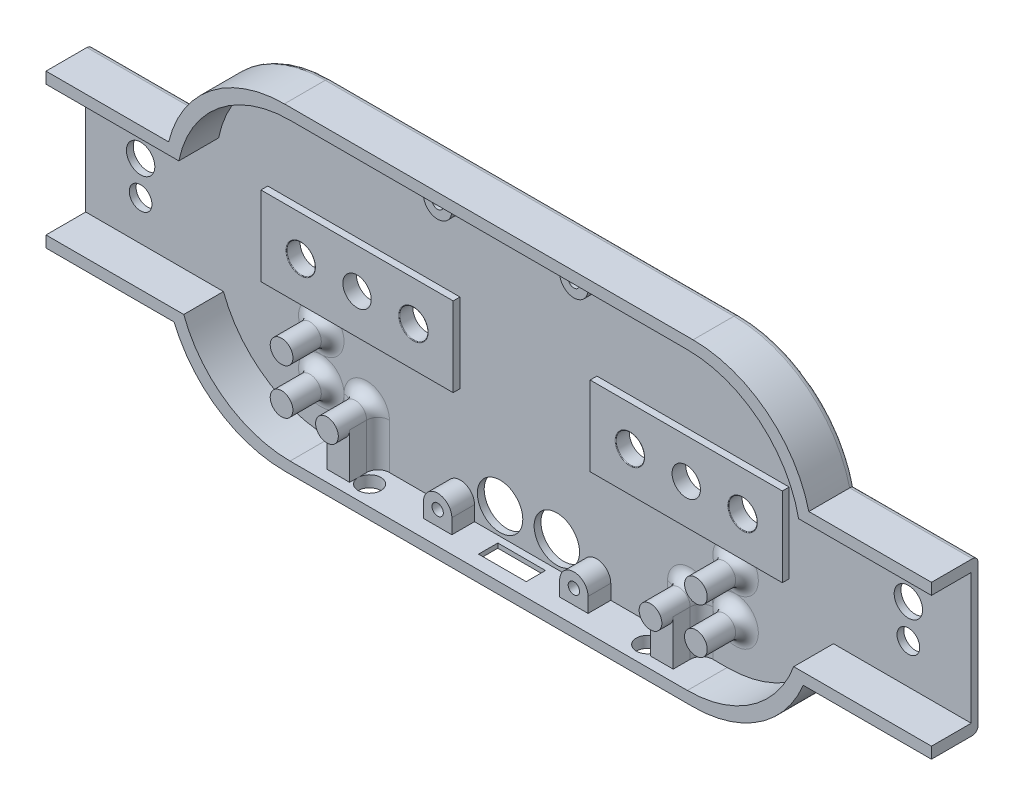
from build123d import *

# Parameters (mm, degrees)
SKETCH_1_W          = 114
SKETCH_1_H          = 56
SKETCH_1_W_2        = 110
SKETCH_1_H_2        = 52
EXTRUDE_1_DEPTH     = 7
SKETCH_3_W          = 114
SKETCH_3_H          = 56
EXTRUDE_2_DEPTH     = 1.2
SKETCH_4_R          = 2.5
CUT_EXTRUDE_1_DEPTH = 1.2
FILLET_2_R          = 20
FILLET_3_R          = 21
SKETCH_5_W          = 33.86
SKETCH_5_H          = 14
EXTRUDE_3_DEPTH     = 1.2
SKETCH_6_R          = 2.5
CUT_EXTRUDE_2_DEPTH = 1.2
FILLET_4_R          = 0.1
SKETCH_7_W          = 23
SKETCH_7_H          = 27
EXTRUDE_4_DEPTH     = 8.2
SKETCH_8_W          = 25
SKETCH_8_H          = 23
CUT_EXTRUDE_3_DEPTH = 7
FILLET_6_R          = 1
SKETCH_9_R          = 2.5
SKETCH_9_R_2        = 2
CUT_EXTRUDE_4_DEPTH = 1.2
SKETCH_10_R         = 2.5
EXTRUDE_5_DEPTH     = 4
SKETCH_11_R         = 1
CUT_EXTRUDE_5_DEPTH = 3
SKETCH_12_W         = 8.4
SKETCH_12_H         = 3.4
CUT_EXTRUDE_6_DEPTH = 3
SKETCH_13_W         = 12.4
SKETCH_13_H         = 6.2
CUT_EXTRUDE_7_DEPTH = 1.2
EXTRUDE_6_DEPTH     = 4
SKETCH_15_R         = 4
CUT_EXTRUDE_8_DEPTH = 4
SKETCH_17_R         = 2
CUT_EXTRUDE_9_DEPTH = 5
SKETCH_18_R         = 2
EXTRUDE_8_DEPTH     = 7
SKETCH_19_W         = 4
SKETCH_19_H         = 8
EXTRUDE_9_DEPTH     = 5
FILLET_10_R         = 2


with BuildPart() as part:
    # Эскиз1 → Вытянуть-Тонкостенный1 (new body)
    with BuildSketch(Plane.XY):
        Rectangle(SKETCH_1_W, SKETCH_1_H)
        Rectangle(SKETCH_1_W_2, SKETCH_1_H_2, mode=Mode.SUBTRACT)
    extrude(amount=EXTRUDE_1_DEPTH)

    # Эскиз3 → Бобышка-Вытянуть2 (add)
    with BuildSketch(Plane(origin=(0, 0, 0), x_dir=(-1, 0, 0), z_dir=(0, 0, -1))):
        Rectangle(SKETCH_3_W, SKETCH_3_H)
    extrude(amount=EXTRUDE_2_DEPTH)

    # Эскиз4 → Вырез-Вытянуть1 (cut)
    with BuildSketch(Plane(origin=(0, 0, -1.2), x_dir=(-1, 0, 0), z_dir=(0, 0, -1))):
        with Locations((29, 0)):
            Circle(SKETCH_4_R)
        with Locations((-29, 0)):
            Circle(SKETCH_4_R)
        with Locations((38.93, 0)):
            Circle(SKETCH_4_R)
        with Locations((19.07, 0)):
            Circle(SKETCH_4_R)
        with Locations((-19.07, 0)):
            Circle(SKETCH_4_R)
        with Locations((-38.93, 0)):
            Circle(SKETCH_4_R)
    extrude(amount=-CUT_EXTRUDE_1_DEPTH, mode=Mode.SUBTRACT)

    # Скругление2
    fillet_2_edges = [part.edges().sort_by_distance(p)[0] for p in [
        (-55, 26, 3.5),
        (-55, -26, 3.5),
        (55, -26, 3.5),
        (55, 26, 3.5),
    ]]
    fillet(fillet_2_edges, radius=FILLET_2_R)

    # Скругление3
    fillet_3_edges = [part.edges().sort_by_distance(p)[0] for p in [
        (-57, 28, 2.9),
        (57, 28, 2.9),
        (57, -28, 2.9),
        (-57, -28, 2.9),
    ]]
    fillet(fillet_3_edges, radius=FILLET_3_R)

    # Эскиз5 → Бобышка-Вытянуть3 (add)
    with BuildSketch(Plane.XY):
        with Locations((29, 0)):
            Rectangle(SKETCH_5_W, SKETCH_5_H)
        with Locations((-29, 0)):
            Rectangle(SKETCH_5_W, SKETCH_5_H)
    extrude(amount=EXTRUDE_3_DEPTH)

    # Эскиз6 → Вырез-Вытянуть2 (cut)
    with BuildSketch(Plane(origin=(0, 0, 0), x_dir=(-1, 0, 0), z_dir=(0, 0, -1))):
        with Locations((19.07, 0)):
            Circle(SKETCH_6_R)
        with Locations((29, 0)):
            Circle(SKETCH_6_R)
        with Locations((38.93, 0)):
            Circle(SKETCH_6_R)
        with Locations((-19.07, 0)):
            Circle(SKETCH_6_R)
        with Locations((-29, 0)):
            Circle(SKETCH_6_R)
        with Locations((-38.93, 0)):
            Circle(SKETCH_6_R)
    extrude(amount=-CUT_EXTRUDE_2_DEPTH, mode=Mode.SUBTRACT)

    # Скругление4
    fillet_4_edges = [part.edges().sort_by_distance(p)[0] for p in [
        (41.43, 0, 1.2),
        (21.57, 0, 1.2),
        (-36.43, 0, 1.2),
        (-16.57, 0, 1.2),
    ]]
    fillet(fillet_4_edges, radius=FILLET_4_R)

    # Эскиз7 → Бобышка-Вытянуть4 (add)
    with BuildSketch(Plane(origin=(0, 0, -1.2), x_dir=(-1, 0, 0), z_dir=(0, 0, -1))):
        with Locations((-66.5, -1.5)):
            Rectangle(SKETCH_7_W, SKETCH_7_H)
        with Locations((66.5, -1.5)):
            Rectangle(SKETCH_7_W, SKETCH_7_H)
    extrude(amount=-EXTRUDE_4_DEPTH)

    # Эскиз8 → Вырез-Вытянуть3 (cut)
    with BuildSketch(Plane.XY.offset(7)):
        with Locations((65.5, -1.5)):
            Rectangle(SKETCH_8_W, SKETCH_8_H)
        with Locations((-65.5, -1.5)):
            Rectangle(SKETCH_8_W, SKETCH_8_H)
    extrude(amount=-CUT_EXTRUDE_3_DEPTH, mode=Mode.SUBTRACT)

    # Скругление6
    # the kernel refuses this fillet: 1 mm, written as the material it takes off along each edge
    with BuildSketch(Plane(origin=(36, -28, -1.2), x_dir=(0, 1, 0), z_dir=(-1, 0, 0)), Plane(origin=(-36, 28, -1.2), x_dir=(0, -1, 0), z_dir=(1, 0, 0))) as fillet_6_piece_1:
        with BuildLine():
            CenterArc((FILLET_6_R, -FILLET_6_R), FILLET_6_R, 90, 90)
            Line((0, -FILLET_6_R), (0, 0))
            Line((0, 0), (FILLET_6_R, 0))
        make_face()
    extrude(amount=72, mode=Mode.SUBTRACT)
    with BuildSketch(Plane(origin=(36, 7, -1.2), x_dir=(0, 1, 0), z_dir=(-1, 0, 0))) as fillet_6_piece_2_section:
        with BuildLine():
            CenterArc((21 - FILLET_6_R, -FILLET_6_R), FILLET_6_R, 0, 90)
            Line((21, -FILLET_6_R), (21, 0))
            Line((21, 0), (21 - FILLET_6_R, 0))
        make_face()
    fillet_6_piece_2 = revolve(axis=Axis((36, 7, -1.2), (0, 0, -1)), revolution_arc=83.048744481, mode=Mode.PRIVATE)
    fillet_6_piece_2 = split(fillet_6_piece_2, bisect_by=Plane(origin=(48.789065716, 12, -0.92065467), z_dir=(0, 1, 0)), keep=Keep.TOP, mode=Mode.PRIVATE)
    add(fillet_6_piece_2, mode=Mode.SUBTRACT)
    with BuildSketch(Plane(origin=(-36, -7, -1.2), x_dir=(0, -1, 0), z_dir=(1, 0, 0))) as fillet_6_piece_3_section:
        with BuildLine():
            CenterArc((21 - FILLET_6_R, -FILLET_6_R), FILLET_6_R, 0, 90)
            Line((21, -FILLET_6_R), (21, 0))
            Line((21, 0), (21 - FILLET_6_R, 0))
        make_face()
    fillet_6_piece_3 = revolve(axis=Axis((-36, -7, -1.2), (0, 0, -1)), revolution_arc=74.429784304, mode=Mode.PRIVATE)
    fillet_6_piece_3 = split(fillet_6_piece_3, bisect_by=Plane(origin=(-47.52760818, -15, -0.920115672), z_dir=(0, -1, 0)), keep=Keep.TOP, mode=Mode.PRIVATE)
    add(fillet_6_piece_3, mode=Mode.SUBTRACT)
    with BuildSketch(Plane(origin=(36, -7, -1.2), x_dir=(0, -1, 0), z_dir=(-1, 0, 0))) as fillet_6_piece_4_section:
        with BuildLine():
            CenterArc((21 - FILLET_6_R, FILLET_6_R), FILLET_6_R, 270, 90)
            Line((21, FILLET_6_R), (21, 0))
            Line((21, 0), (21 - FILLET_6_R, 0))
        make_face()
    fillet_6_piece_4 = revolve(axis=Axis((36, -7, -1.2), (0, 0, 1)), revolution_arc=74.429784304, mode=Mode.PRIVATE)
    fillet_6_piece_4 = split(fillet_6_piece_4, bisect_by=Plane(origin=(47.52760818, -15, -0.920115672), z_dir=(0, -1, 0)), keep=Keep.TOP, mode=Mode.PRIVATE)
    add(fillet_6_piece_4, mode=Mode.SUBTRACT)
    with BuildSketch(Plane(origin=(52.916487839, -15, -1.2), x_dir=(0, 1, 0), z_dir=(1, 0, 0))) as fillet_6_piece_5_section:
        with BuildLine():
            CenterArc((FILLET_6_R, FILLET_6_R), FILLET_6_R, 180, 90)
            Line((0, FILLET_6_R), (0, 0))
            Line((0, 0), (FILLET_6_R, 0))
        make_face()
    fillet_6_piece_5 = extrude(amount=27.583512161, mode=Mode.PRIVATE)
    fillet_6_piece_5 = fillet_6_piece_5 - Plane(origin=(36, -7, -0.973171479), x_dir=(0, -1, 0), z_dir=(0, 0, 1)) * Cylinder(21, 60, mode=Mode.PRIVATE)
    add(fillet_6_piece_5, mode=Mode.SUBTRACT)
    with BuildSketch(Plane(origin=(80.5, 12, -1.2), x_dir=(0, -1, 0), z_dir=(-1, 0, 0))) as fillet_6_piece_6_section:
        with BuildLine():
            CenterArc((FILLET_6_R, FILLET_6_R), FILLET_6_R, 180, 90)
            Line((0, FILLET_6_R), (0, 0))
            Line((0, 0), (FILLET_6_R, 0))
        make_face()
    fillet_6_piece_6 = extrude(amount=26.603921946, mode=Mode.PRIVATE)
    fillet_6_piece_6 = fillet_6_piece_6 - Plane(origin=(36, 7, -0.973342588), x_dir=(0, 1, 0), z_dir=(0, 0, 1)) * Cylinder(21, 58, mode=Mode.PRIVATE)
    add(fillet_6_piece_6, mode=Mode.SUBTRACT)
    with BuildSketch(Plane(origin=(-36, 7, -1.2), x_dir=(-0.992649472985571, 0.12102488909917623, 0), z_dir=(-0.12102488909917623, -0.992649472985571, 0))) as fillet_6_piece_7_section:
        with BuildLine():
            CenterArc((21 - FILLET_6_R, -FILLET_6_R), FILLET_6_R, 0, 90)
            Line((21, -FILLET_6_R), (21, 0))
            Line((21, 0), (21 - FILLET_6_R, 0))
        make_face()
    fillet_6_piece_7 = revolve(axis=Axis((-36, 7, -1.2), (0, 0, -1)), revolution_arc=83.048744481, mode=Mode.PRIVATE)
    fillet_6_piece_7 = split(fillet_6_piece_7, bisect_by=Plane(origin=(-48.789065726, 12, -0.920654686), z_dir=(0, 1, 0)), keep=Keep.TOP, mode=Mode.PRIVATE)
    add(fillet_6_piece_7, mode=Mode.SUBTRACT)
    with BuildSketch(Plane(origin=(-52.916487839, -15, -1.2), x_dir=(0, 1, 0), z_dir=(-1, 0, 0))) as fillet_6_piece_8_section:
        with BuildLine():
            CenterArc((FILLET_6_R, -FILLET_6_R), FILLET_6_R, 90, 90)
            Line((0, -FILLET_6_R), (0, 0))
            Line((0, 0), (FILLET_6_R, 0))
        make_face()
    fillet_6_piece_8 = extrude(amount=27.583512161, mode=Mode.PRIVATE)
    fillet_6_piece_8 = fillet_6_piece_8 - Plane(origin=(-36, -7, -0.973171479), x_dir=(0, -1, 0), z_dir=(0, 0, -1)) * Cylinder(21, 60, mode=Mode.PRIVATE)
    add(fillet_6_piece_8, mode=Mode.SUBTRACT)
    with BuildSketch(Plane(origin=(-80.5, 12, -1.2), x_dir=(0, -1, 0), z_dir=(1, 0, 0))) as fillet_6_piece_9_section:
        with BuildLine():
            CenterArc((FILLET_6_R, -FILLET_6_R), FILLET_6_R, 90, 90)
            Line((0, -FILLET_6_R), (0, 0))
            Line((0, 0), (FILLET_6_R, 0))
        make_face()
    fillet_6_piece_9 = extrude(amount=26.603921946, mode=Mode.PRIVATE)
    fillet_6_piece_9 = fillet_6_piece_9 - Plane(origin=(-36, 7, -0.973341813), x_dir=(-1, 0, 0), z_dir=(0, 0, -1)) * Cylinder(21, 58, mode=Mode.PRIVATE)
    add(fillet_6_piece_9, mode=Mode.SUBTRACT)
    with BuildSketch(Plane(origin=(36, 7, -1.2), x_dir=(0, 1, 0), z_dir=(-1, 0, 0))) as fillet_6_piece_10a_section:
        with BuildLine():
            CenterArc((21 - FILLET_6_R, -FILLET_6_R), FILLET_6_R, 0, 90)
            Line((21, -FILLET_6_R), (21, 0))
            Line((21, 0), (21 - FILLET_6_R, 0))
        make_face()
    fillet_6_piece_10a = revolve(axis=Axis((36, 7, -1.2), (0, 0, -1)), revolution_arc=83.048744481, mode=Mode.PRIVATE)
    fillet_6_piece_10a = split(fillet_6_piece_10a, bisect_by=Plane(origin=(56.414769846, 12, -0.974975754), z_dir=(0, -1, 0)), keep=Keep.TOP, mode=Mode.PRIVATE)
    with BuildSketch(Plane(origin=(80.5, 12, -1.2), x_dir=(0, -1, 0), z_dir=(-1, 0, 0))) as fillet_6_piece_10b_section:
        with BuildLine():
            CenterArc((FILLET_6_R, FILLET_6_R), FILLET_6_R, 180, 90)
            Line((0, FILLET_6_R), (0, 0))
            Line((0, 0), (FILLET_6_R, 0))
        make_face()
    fillet_6_piece_10b = extrude(amount=26.603921946, mode=Mode.PRIVATE)
    fillet_6_piece_10b = fillet_6_piece_10b & Plane(origin=(36, 7, -0.97607829), x_dir=(0, 1, 0), z_dir=(0, 0, 1)) * Cylinder(21, 58, mode=Mode.PRIVATE)
    fillet_6_piece_10 = fillet_6_piece_10a & fillet_6_piece_10b
    add(fillet_6_piece_10, mode=Mode.SUBTRACT)
    with BuildSketch(Plane(origin=(-36, -7, -1.2), x_dir=(0, -1, 0), z_dir=(1, 0, 0))) as fillet_6_piece_11a_section:
        with BuildLine():
            CenterArc((21 - FILLET_6_R, -FILLET_6_R), FILLET_6_R, 0, 90)
            Line((21, -FILLET_6_R), (21, 0))
            Line((21, 0), (21 - FILLET_6_R, 0))
        make_face()
    fillet_6_piece_11a = revolve(axis=Axis((-36, -7, -1.2), (0, 0, -1)), revolution_arc=74.429784304, mode=Mode.PRIVATE)
    fillet_6_piece_11a = split(fillet_6_piece_11a, bisect_by=Plane(origin=(-55.610805673, -15, -0.976749191), z_dir=(0, 1, 0)), keep=Keep.TOP, mode=Mode.PRIVATE)
    with BuildSketch(Plane(origin=(-52.916487839, -15, -1.2), x_dir=(0, 1, 0), z_dir=(-1, 0, 0))) as fillet_6_piece_11b_section:
        with BuildLine():
            CenterArc((FILLET_6_R, -FILLET_6_R), FILLET_6_R, 90, 90)
            Line((0, -FILLET_6_R), (0, 0))
            Line((0, 0), (FILLET_6_R, 0))
        make_face()
    fillet_6_piece_11b = extrude(amount=27.583512161, mode=Mode.PRIVATE)
    fillet_6_piece_11b = fillet_6_piece_11b & Plane(origin=(-36, -7, -0.977786604), x_dir=(0, -1, 0), z_dir=(0, 0, -1)) * Cylinder(21, 60, mode=Mode.PRIVATE)
    fillet_6_piece_11 = fillet_6_piece_11a & fillet_6_piece_11b
    add(fillet_6_piece_11, mode=Mode.SUBTRACT)
    with BuildSketch(Plane(origin=(52.916487839, -15, -1.2), x_dir=(0, 1, 0), z_dir=(1, 0, 0))) as fillet_6_piece_12a_section:
        with BuildLine():
            CenterArc((FILLET_6_R, FILLET_6_R), FILLET_6_R, 180, 90)
            Line((0, FILLET_6_R), (0, 0))
            Line((0, 0), (FILLET_6_R, 0))
        make_face()
    fillet_6_piece_12a = extrude(amount=27.583512161, mode=Mode.PRIVATE)
    fillet_6_piece_12a = fillet_6_piece_12a & Plane(origin=(36, -7, -0.977786604), x_dir=(0, -1, 0), z_dir=(0, 0, 1)) * Cylinder(21, 60, mode=Mode.PRIVATE)
    with BuildSketch(Plane(origin=(36, -7, -1.2), x_dir=(0, -1, 0), z_dir=(-1, 0, 0))) as fillet_6_piece_12b_section:
        with BuildLine():
            CenterArc((21 - FILLET_6_R, FILLET_6_R), FILLET_6_R, 270, 90)
            Line((21, FILLET_6_R), (21, 0))
            Line((21, 0), (21 - FILLET_6_R, 0))
        make_face()
    fillet_6_piece_12b = revolve(axis=Axis((36, -7, -1.2), (0, 0, 1)), revolution_arc=74.429784304, mode=Mode.PRIVATE)
    fillet_6_piece_12b = split(fillet_6_piece_12b, bisect_by=Plane(origin=(55.610805673, -15, -0.976749191), z_dir=(0, 1, 0)), keep=Keep.TOP, mode=Mode.PRIVATE)
    fillet_6_piece_12 = fillet_6_piece_12a & fillet_6_piece_12b
    add(fillet_6_piece_12, mode=Mode.SUBTRACT)
    with BuildSketch(Plane(origin=(-80.5, 12, -1.2), x_dir=(0, -1, 0), z_dir=(1, 0, 0))) as fillet_6_piece_13a_section:
        with BuildLine():
            CenterArc((FILLET_6_R, -FILLET_6_R), FILLET_6_R, 90, 90)
            Line((0, -FILLET_6_R), (0, 0))
            Line((0, 0), (FILLET_6_R, 0))
        make_face()
    fillet_6_piece_13a = extrude(amount=26.603921946, mode=Mode.PRIVATE)
    fillet_6_piece_13a = fillet_6_piece_13a & Plane(origin=(-36, 7, -0.976077479), x_dir=(-1, 0, 0), z_dir=(0, 0, -1)) * Cylinder(21, 58, mode=Mode.PRIVATE)
    with BuildSketch(Plane(origin=(-36, 7, -1.2), x_dir=(-0.992649472985571, 0.12102488909917623, 0), z_dir=(-0.12102488909917623, -0.992649472985571, 0))) as fillet_6_piece_13b_section:
        with BuildLine():
            CenterArc((21 - FILLET_6_R, -FILLET_6_R), FILLET_6_R, 0, 90)
            Line((21, -FILLET_6_R), (21, 0))
            Line((21, 0), (21 - FILLET_6_R, 0))
        make_face()
    fillet_6_piece_13b = revolve(axis=Axis((-36, 7, -1.2), (0, 0, -1)), revolution_arc=83.048744481, mode=Mode.PRIVATE)
    fillet_6_piece_13b = split(fillet_6_piece_13b, bisect_by=Plane(origin=(-56.414769555, 12, -0.974975815), z_dir=(0, -1, 0)), keep=Keep.TOP, mode=Mode.PRIVATE)
    fillet_6_piece_13 = fillet_6_piece_13a & fillet_6_piece_13b
    add(fillet_6_piece_13, mode=Mode.SUBTRACT)

    # Эскиз9 → Вырез-Вытянуть4 (cut)
    with BuildSketch(Plane.XY):
        with Locations((-68.33, 0)):
            Circle(SKETCH_9_R)
        with Locations((66.93, 0)):
            Circle(SKETCH_9_R)
        with Locations((-68.33, -6)):
            Circle(SKETCH_9_R_2)
        with Locations((66.93, -6)):
            Circle(SKETCH_9_R_2)
    extrude(amount=-CUT_EXTRUDE_4_DEPTH, mode=Mode.SUBTRACT)

    # Эскиз10 → Бобышка-Вытянуть5 (add)
    with BuildSketch(Plane.XY):
        with Locations(Location((12, -23.4, 0), (0, 0, 180))):
            Circle(SKETCH_10_R)
        with Locations(Location((-12, -23.4, 0), (0, 0, 180))):
            Circle(SKETCH_10_R)
        with Locations(Location((12, 23.4, 0), (0, 0, 180))):
            Circle(SKETCH_10_R)
        with Locations(Location((-12, 23.4, 0), (0, 0, 180))):
            Circle(SKETCH_10_R)
    extrude(amount=EXTRUDE_5_DEPTH)

    # Эскиз11 → Вырез-Вытянуть5 (cut)
    with BuildSketch(Plane.XY.offset(4)):
        with Locations((12, -23.4)):
            Circle(SKETCH_11_R)
        with Locations((-12, -23.4)):
            Circle(SKETCH_11_R)
        with Locations((12, 23.4)):
            Circle(SKETCH_11_R)
        with Locations((-12, 23.4)):
            Circle(SKETCH_11_R)
    extrude(amount=-CUT_EXTRUDE_5_DEPTH, mode=Mode.SUBTRACT)

    # Эскиз12 → Вырез-Вытянуть6 (cut)
    with BuildSketch(Plane.XZ.offset(28)):
        with Locations((0, 2.9)):
            Rectangle(SKETCH_12_W, SKETCH_12_H)
    extrude(amount=-CUT_EXTRUDE_6_DEPTH, mode=Mode.SUBTRACT)

    # Эскиз13 → Вырез-Вытянуть7 (cut)
    with BuildSketch(Plane.XZ.offset(28)):
        with Locations((0, 2.9)):
            Rectangle(SKETCH_13_W, SKETCH_13_H)
    extrude(amount=-CUT_EXTRUDE_7_DEPTH, mode=Mode.SUBTRACT)

    # Эскиз14 → Бобышка-Вытянуть6 (add)
    with BuildSketch(Plane.XY.offset(4)):
        Polygon((14.5, -23.4), (14.5, -26), (9.5, -26), (9.5, -23.4), (12, -25.9), align=None)
        Polygon((-9.5, -23.4), (-9.5, -26), (-14.5, -26), (-14.5, -23.4), (-12, -25.9), align=None)
        Polygon((14.5, 23.4), (14.5, 26), (9.5, 26), (9.5, 23.4), (12, 25.9), align=None)
        Polygon((-9.5, 23.4), (-9.5, 26), (-14.5, 26), (-14.5, 23.4), (-12, 25.9), align=None)
    extrude(amount=-EXTRUDE_6_DEPTH)

    # Эскиз15 → Вырез-Вытянуть8 (cut)
    with BuildSketch(Plane.XY):
        with Locations((5, -21.4)):
            Circle(SKETCH_15_R)
        with Locations((-5, -21.4)):
            Circle(SKETCH_15_R)
    extrude(amount=-CUT_EXTRUDE_8_DEPTH, mode=Mode.SUBTRACT)

    # Эскиз17 → Вырез-Вытянуть9 (cut)
    with BuildSketch(Plane(origin=(0, -26, 0), x_dir=(1, 0, 0), z_dir=(0, 1, 0))):
        with Locations(Location((-24.5, -3.5, 0), (0, 0, 270))):
            Circle(SKETCH_17_R)
        with Locations(Location((24.5, -3.5, 0), (0, 0, 270))):
            Circle(SKETCH_17_R)
    extrude(amount=-CUT_EXTRUDE_9_DEPTH, mode=Mode.SUBTRACT)

    # Эскиз18 → Бобышка-Вытянуть8 (add)
    with BuildSketch(Plane.XY):
        with Locations(Location((28.5, -18, 0), (0, 0, 180))):
            Circle(SKETCH_18_R)
        with Locations(Location((36.5, -18, 0), (0, 0, 180))):
            Circle(SKETCH_18_R)
        with Locations(Location((36.5, -10, 0), (0, 0, 180))):
            Circle(SKETCH_18_R)
        with Locations(Location((-28.5, -18, 0), (0, 0, 180))):
            Circle(SKETCH_18_R)
        with Locations(Location((-36.5, -18, 0), (0, 0, 180))):
            Circle(SKETCH_18_R)
        with Locations(Location((-36.5, -10, 0), (0, 0, 180))):
            Circle(SKETCH_18_R)
    extrude(amount=EXTRUDE_8_DEPTH)

    # Эскиз19 → Бобышка-Вытянуть9 (add)
    with BuildSketch(Plane.XY):
        with Locations((-28.5, -22)):
            Rectangle(SKETCH_19_W, SKETCH_19_H)
        with Locations((28.5, -22)):
            Rectangle(SKETCH_19_W, SKETCH_19_H)
    extrude(amount=EXTRUDE_9_DEPTH)

    # Скругление10
    # the kernel refuses this fillet: 2 mm, written as the material it adds along each edge
    with BuildSketch(Plane(origin=(36.5, -18, 0), x_dir=(-1, 0, 0), z_dir=(0, 1, 0))) as fillet_10_piece_1:
        with BuildLine():
            CenterArc((2 + FILLET_10_R, FILLET_10_R), FILLET_10_R, 180, 90)
            Line((2, FILLET_10_R), (2, 0))
            Line((2, 0), (2 + FILLET_10_R, 0))
        make_face()
    revolve(axis=Axis((36.5, -18, 0), (0, 0, 1)))
    with BuildSketch(Plane(origin=(36.5, -10, 0), x_dir=(-1, 0, 0), z_dir=(0, 1, 0))) as fillet_10_piece_2:
        with BuildLine():
            CenterArc((2 + FILLET_10_R, FILLET_10_R), FILLET_10_R, 180, 90)
            Line((2, FILLET_10_R), (2, 0))
            Line((2, 0), (2 + FILLET_10_R, 0))
        make_face()
    revolve(axis=Axis((36.5, -10, 0), (0, 0, 1)))
    with BuildSketch(Plane(origin=(-36.5, -18, 0), x_dir=(-1, 0, 0), z_dir=(0, 1, 0))) as fillet_10_piece_3:
        with BuildLine():
            CenterArc((2 + FILLET_10_R, FILLET_10_R), FILLET_10_R, 180, 90)
            Line((2, FILLET_10_R), (2, 0))
            Line((2, 0), (2 + FILLET_10_R, 0))
        make_face()
    revolve(axis=Axis((-36.5, -18, 0), (0, 0, 1)))
    with BuildSketch(Plane(origin=(-36.5, -10, 0), x_dir=(-1, 0, 0), z_dir=(0, 1, 0))) as fillet_10_piece_4:
        with BuildLine():
            CenterArc((2 + FILLET_10_R, FILLET_10_R), FILLET_10_R, 180, 90)
            Line((2, FILLET_10_R), (2, 0))
            Line((2, 0), (2 + FILLET_10_R, 0))
        make_face()
    revolve(axis=Axis((-36.5, -10, 0), (0, 0, 1)))
    with BuildSketch(Plane(origin=(-28.5, -18, 0), x_dir=(1, 0, 0), z_dir=(0, -1, 0))) as fillet_10_piece_5:
        with BuildLine():
            CenterArc((2 + FILLET_10_R, FILLET_10_R), FILLET_10_R, 180, 90)
            Line((2, FILLET_10_R), (2, 0))
            Line((2, 0), (2 + FILLET_10_R, 0))
        make_face()
    revolve(axis=Axis((-28.5, -18, 0), (0, 0, 1)), revolution_arc=180)
    with BuildSketch(Plane(origin=(-30.5, -26, 0), x_dir=(-1, 0, 0), z_dir=(0, 1, 0)), Plane(origin=(-26.5, -18, 0), x_dir=(1, 0, 0), z_dir=(0, -1, 0)), Plane(origin=(30.5, -18, 0), x_dir=(1, 0, 0), z_dir=(0, -1, 0)), Plane(origin=(26.5, -26, 0), x_dir=(-1, 0, 0), z_dir=(0, 1, 0))) as fillet_10_piece_6:
        with BuildLine():
            CenterArc((FILLET_10_R, FILLET_10_R), FILLET_10_R, 180, 90)
            Line((0, FILLET_10_R), (0, 0))
            Line((0, 0), (FILLET_10_R, 0))
        make_face()
    extrude(amount=8)
    with BuildSketch(Plane(origin=(28.5, -18, 0), x_dir=(1, 0, 0), z_dir=(0, -1, 0))) as fillet_10_piece_7:
        with BuildLine():
            CenterArc((2 + FILLET_10_R, FILLET_10_R), FILLET_10_R, 180, 90)
            Line((2, FILLET_10_R), (2, 0))
            Line((2, 0), (2 + FILLET_10_R, 0))
        make_face()
    revolve(axis=Axis((28.5, -18, 0), (0, 0, 1)), revolution_arc=180)


solid = part.part
